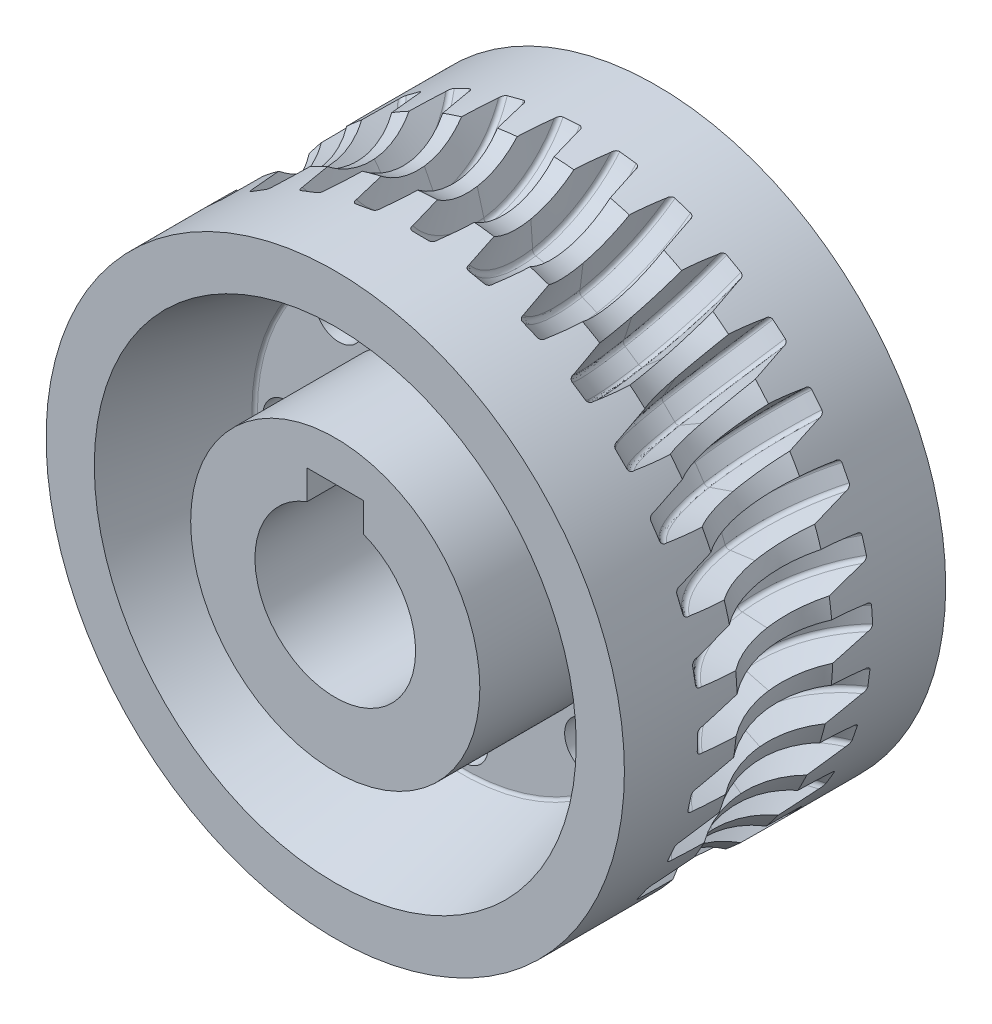
from build123d import *

# Parameters (mm, degrees)
CUT_EXTRUDE1_REACH     = 34.373
SKETCH5_W              = 3.5
SKETCH5_H              = 6.5
CUT_SWEEP1_PITCH       = 5
CUT_SWEEP1_HEIGHT      = 1.25
CUT_SWEEP1_RADIUS      = 5
CUT_SWEEP1_START_ANGLE = -90
CUT_SWEEP2_PITCH       = 5
CUT_SWEEP2_HEIGHT      = 1.25
CUT_SWEEP2_RADIUS      = 5
CUT_SWEEP2_START_ANGLE = -90
CIRPATTERN1_COUNT      = 32
CUT_EXTRUDE2_REACH     = 30.33
SKETCH11_R             = 1.5
CIRPATTERN2_COUNT      = 8
FILLET1_R              = 0.2


with BuildPart() as part:
    # Sketch3 → Revolve1 (revolve)
    with BuildSketch(Plane(origin=(0, 0, 0), x_dir=(0, 0, -1), z_dir=(1, 0, 0)), mode=Mode.PRIVATE) as revolve1_sk:
        Polygon((-10, 5), (10, 5), (10, 9), (2, 9), (2, 13), (10, 15), (10, 20), (-10, 20), (-10, 15), (-2, 13), (-2, 9), (-10, 9), align=None)
    revolve(revolve1_sk.sketch.rotate(Axis((0, 0, 11.043478261), (0, 0, -1)), 90), axis=Axis((0, 0, 11.043478261), (0, 0, -1)))

    # Sketch4 → Cut-Revolve4 (revolve, cut)
    with BuildSketch(Plane(origin=(0, 0, 0), x_dir=(0, 0, -1), z_dir=(1, 0, 0)), mode=Mode.PRIVATE) as cut_revolve4_sk:
        with BuildLine():
            Line((2.976178884, 18), (10, 18))
            Line((10, 18), (10, 20))
            Line((10, 20), (-2.55243708, 20))
            Line((-2.55243708, 20), (-10, 20))
            Line((-10, 20), (-10, 18))
            Line((-10, 18), (-2.976178884, 18))
            ThreePointArc((-2.976178884, 18), (0, 17.017755499), (2.976178884, 18))
        make_face()
    revolve(cut_revolve4_sk.sketch.rotate(Axis((0, 0, 24.980063232), (0, 0, -1)), 90), axis=Axis((0, 0, 24.980063232), (0, 0, -1)), mode=Mode.SUBTRACT)

    # Sketch5 → Cut-Extrude1 (cut, up to next)
    with BuildSketch(Plane(origin=(0, 0, -10), x_dir=(-1, 0, 0), z_dir=(0, 0, -1)), mode=Mode.PRIVATE) as cut_extrude1_sk1:
        with Locations((0, 3.25)):
            Rectangle(SKETCH5_W, SKETCH5_H)
    cut_extrude1_tool1 = extrude(cut_extrude1_sk1.sketch, amount=-CUT_EXTRUDE1_REACH, mode=Mode.PRIVATE) & part.part
    add(cut_extrude1_tool1.solids().sort_by_distance((0, 3.25, -10))[0], mode=Mode.SUBTRACT)

    # Cut-Sweep1: sweep along a helix
    with BuildLine() as cut_sweep1_path:
        add(Helix(CUT_SWEEP1_PITCH, CUT_SWEEP1_HEIGHT, CUT_SWEEP1_RADIUS, center=(0, -22.017755499, 0), direction=(1, 0, 0), lefthand=True, mode=Mode.PRIVATE).rotate(Axis((0, -22.017755499, 0), (1, 0, 0)), CUT_SWEEP1_START_ANGLE))
    # Sketch9 → Cut-Sweep1 (sweep, cut)
    with BuildSketch(Plane.XY):
        with BuildLine():
            Line((-0.5, -15.241728395), (0.5, -15.241728395))
            ThreePointArc((0.5, -15.241728395), (0.676776695, -15.3149517), (0.75, -15.491728395))
            Line((0.75, -15.491728395), (1.171891316, -17.017755499))
            Line((1.171891316, -17.017755499), (1.171891316, -18.462945051))
            Line((1.171891316, -18.462945051), (-1.152065387, -18.462945051))
            Line((-1.152065387, -18.462945051), (-1.152065387, -17.017755499))
            Line((-1.152065387, -17.017755499), (-0.75, -15.491728395))
            ThreePointArc((-0.75, -15.491728395), (-0.676776695, -15.3149517), (-0.5, -15.241728395))
        make_face()
    cut_sweep1 = sweep(path=cut_sweep1_path.line, is_frenet=True, mode=Mode.SUBTRACT)

    # Cut-Sweep2: sweep along a helix
    with BuildLine() as cut_sweep2_path:
        add(Helix(CUT_SWEEP2_PITCH, CUT_SWEEP2_HEIGHT, CUT_SWEEP2_RADIUS, center=(0, -22.017755499, 0), direction=(-1, 0, 0), lefthand=True, mode=Mode.PRIVATE).rotate(Axis((0, -22.017755499, 0), (-1, 0, 0)), CUT_SWEEP2_START_ANGLE))
    # Sketch9<2> → Cut-Sweep2 (sweep, cut)
    with BuildSketch(Plane.XY):
        with BuildLine():
            Line((-0.5, -15.241728395), (0.5, -15.241728395))
            ThreePointArc((0.5, -15.241728395), (0.676776695, -15.3149517), (0.75, -15.491728395))
            Line((0.75, -15.491728395), (1.171891316, -17.017755499))
            Line((1.171891316, -17.017755499), (1.171891316, -18.462945051))
            Line((1.171891316, -18.462945051), (-1.152065387, -18.462945051))
            Line((-1.152065387, -18.462945051), (-1.152065387, -17.017755499))
            Line((-1.152065387, -17.017755499), (-0.75, -15.491728395))
            ThreePointArc((-0.75, -15.491728395), (-0.676776695, -15.3149517), (-0.5, -15.241728395))
        make_face()
    cut_sweep2 = sweep(path=cut_sweep2_path.line, is_frenet=True, mode=Mode.SUBTRACT)

    # CirPattern1: Cut-Sweep1, Cut-Sweep2 ×32 about axis
    cirpattern1_axis = Axis((0, 0, 11.043478261), (0, 0, 1))
    add([cut_sweep1.rotate(cirpattern1_axis, i * 360 / CIRPATTERN1_COUNT) for i in range(1, CIRPATTERN1_COUNT)], mode=Mode.SUBTRACT)
    add([cut_sweep2.rotate(cirpattern1_axis, i * 360 / CIRPATTERN1_COUNT) for i in range(1, CIRPATTERN1_COUNT)], mode=Mode.SUBTRACT)

    # Sketch11 → Cut-Extrude2 (cut, up to next)
    with BuildSketch(Plane(origin=(0, 0, -2), x_dir=(-1, 0, 0), z_dir=(0, 0, -1)), mode=Mode.PRIVATE) as cut_extrude2_sk1:
        with Locations((0, 11)):
            Circle(SKETCH11_R)
    cut_extrude2_tool1 = extrude(cut_extrude2_sk1.sketch, amount=-CUT_EXTRUDE2_REACH, mode=Mode.PRIVATE) & part.part
    cut_extrude2 = cut_extrude2_tool1.solids().sort_by_distance((0, 11, -2))[0]
    add(cut_extrude2, mode=Mode.SUBTRACT)

    # CirPattern2: Cut-Extrude2 ×8 about axis
    cirpattern2_axis = Axis((0, 0, 0), (0, 0, 1))
    for i in range(1, CIRPATTERN2_COUNT):
        add(cut_extrude2.rotate(cirpattern2_axis, i * 360 / CIRPATTERN2_COUNT), mode=Mode.SUBTRACT)

    # Fillet1
    fillet1_edges = [part.edges().sort_by_distance(p)[0] for p in [
        (-13, 0, -2),
        (-13, 0, 2),
    ]]
    fillet(fillet1_edges, radius=FILLET1_R)


solid = part.part
